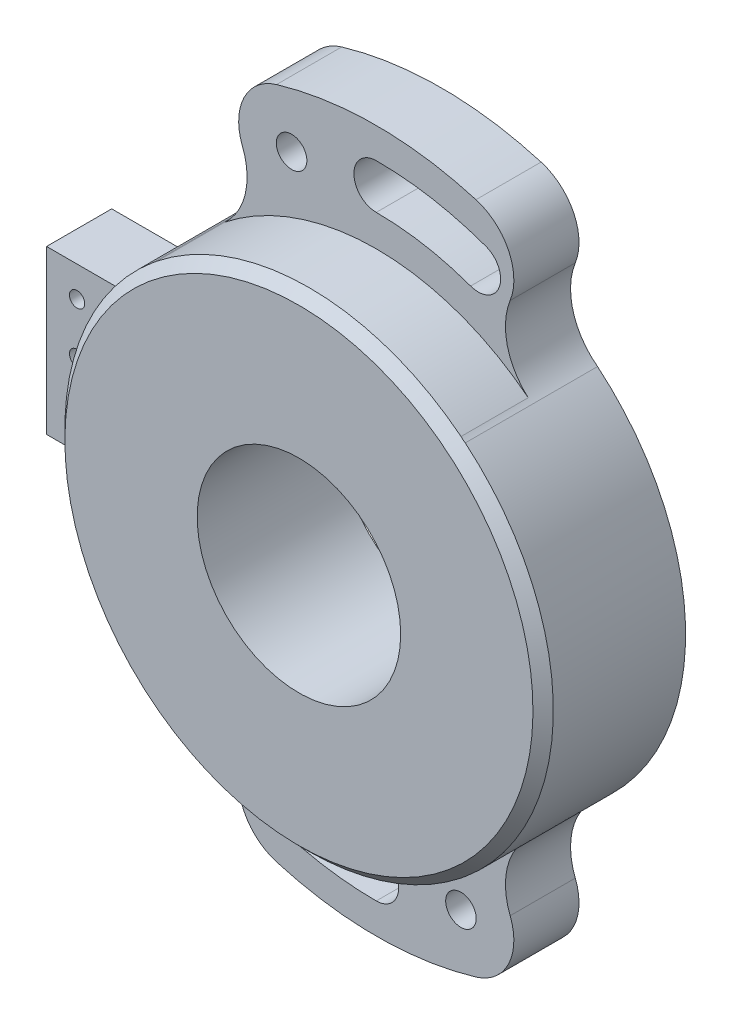
from build123d import *

# Parameters (mm, degrees)
SKETCH1_R           = 5
BOSS_EXTRUDE1_DEPTH = 7
SKETCH1_3_R         = 0.75
SKETCH1_3_R_2       = 0.37500000000000105
SKETCH1_3_R_3       = 0.375000000000001
SKETCH1_3_R_4       = 0.7500000000000001
BOSS_EXTRUDE2_DEPTH = 3.2
CHAMFER1_SIZE       = 0.5


with BuildPart() as part:
    # Sketch1 → Boss-Extrude1 (new body)
    with BuildSketch(Plane.XY):
        with BuildLine():
            ThreePointArc((-7.67241426287147, 9.226811983501475), (-9.846222893058407, 6.8594383691533025), (-11.31370849898476, 4))
            ThreePointArc((-11.31370849898476, 4), (-12, 1.47e-15), (-11.313708498984761, -3.9999999999999973))
            ThreePointArc((-11.313708498984761, -3.9999999999999973), (-9.846222893058428, -6.859438369153274), (-7.672414262871522, -9.226811983501433))
            ThreePointArc((-7.672414262871518, -9.226811983501431), (-7.566872377799013, -9.309109229750973), (-7.464748895834485, -9.395611950380768))
            ThreePointArc((-7.464748895834483, -9.395611950380767), (1.911e-14, -12), (7.464748895834521, -9.395611950380736))
            ThreePointArc((7.464748895834522, -9.395611950380738), (7.566872377798977, -9.309109229751012), (7.6724142628714045, -9.226811983501536))
            ThreePointArc((7.672414262871396, -9.226811983501538), (10.864367702596793, -5.0956368024783405), (12, -2.94e-15))
            ThreePointArc((12, 0), (10.864367702596812, 5.095636802478297), (7.672414262871458, 9.226811983501484))
            ThreePointArc((7.672414262871453, 9.22681198350148), (7.5668723777987985, 9.309109229751144), (7.4647488958341315, 9.395611950381072))
            ThreePointArc((7.464748895834118, 9.395611950381056), (-2.7638e-13, 12), (-7.464748895834552, 9.395611950380712))
            ThreePointArc((-7.464748895834552, 9.395611950380712), (-7.566872377799023, 9.30910922975097), (-7.672414262871468, 9.226811983501477))
        make_face()
        Circle(SKETCH1_R, mode=Mode.SUBTRACT)
    extrude(amount=BOSS_EXTRUDE1_DEPTH)

    # Sketch1<3> → Boss-Extrude2 (add)
    # profile 1 of 3: a face of its own
    with BuildSketch(Plane.XY):
        with BuildLine():
            ThreePointArc((-6.57839458957231, 13.089966563130929), (-6.4376977661817865, 11.10270546197924), (-7.464748895834552, 9.395611950380712))
            ThreePointArc((-7.464748895834552, 9.395611950380712), (-2.7638e-13, 12), (7.464748895834118, 9.395611950381056))
            ThreePointArc((7.4647488958341315, 9.395611950381072), (6.437697766181707, 11.102705461979504), (6.578394589572291, 13.089966563130933))
            ThreePointArc((6.578394589572291, 13.089966563130933), (6.498593335336791, 15.184618723292306), (4.899264696142665, 16.53964042647633))
            ThreePointArc((4.899264696142668, 16.539640426476332), (-9.55e-15, 17.250000000000007), (-4.899264696142684, 16.539640426476325))
            ThreePointArc((-4.899264696142685, 16.539640426476325), (-6.49859333533681, 15.184618723292303), (-6.57839458957231, 13.089966563130929))
        make_face()
        with Locations((-4.160824799912482, 14.046709115819024)):
            Circle(SKETCH1_3_R, mode=Mode.SUBTRACT)
        with BuildLine():
            ThreePointArc((-2e-17, 13.55), (-1.1000000000000003, 14.65), (1.8e-16, 15.75))
            ThreePointArc((1.8e-16, 15.75), (2.734958798254155, 15.510722109942275), (5.3868172573792865, 14.800158777378059))
            ThreePointArc((5.3868172573792865, 14.800158777378059), (6.04425698258554, 13.390274736855329), (4.634372942062814, 12.732835011649062))
            ThreePointArc((4.634372942062814, 12.732835011649065), (2.352932807386907, 13.344145053315419), (-2e-17, 13.550000000000002))
        make_face(mode=Mode.SUBTRACT)
    # profile 2 of 3: a face of its own
    with BuildSketch(Plane.XY):
        with BuildLine():
            Line((-11.313708498984761, 3.9999999999999982), (-16.2, 4))
            Line((-16.2, 4), (-16.2, -4))
            Line((-16.2, -4), (-11.313708498984761, -3.9999999999999982))
            ThreePointArc((-11.313708498984761, -3.9999999999999973), (-12, 1.47e-15), (-11.31370849898476, 4))
        make_face()
        with Locations((-14.7, -2.5)):
            Circle(SKETCH1_3_R_2, mode=Mode.SUBTRACT)
        with Locations((-14.7, 0)):
            Circle(SKETCH1_3_R_3, mode=Mode.SUBTRACT)
        with Locations((-14.7, 2.5)):
            Circle(SKETCH1_3_R_2, mode=Mode.SUBTRACT)
    # profile 3 of 3: a face of its own
    with BuildSketch(Plane.XY):
        with BuildLine():
            ThreePointArc((7.464748895834521, -9.395611950380736), (1.911e-14, -12), (-7.464748895834483, -9.395611950380767))
            ThreePointArc((-7.464748895834485, -9.395611950380768), (-6.437697766181827, -11.102705461979276), (-6.578394589572382, -13.08996656313089))
            ThreePointArc((-6.578394589572383, -13.08996656313089), (-6.498593335336874, -15.184618723292306), (-4.899264696142685, -16.539640426476325))
            ThreePointArc((-4.899264696142686, -16.539640426476325), (-2e-15, -17.250000000000004), (4.899264696142684, -16.53964042647633))
            ThreePointArc((4.899264696142683, -16.539640426476325), (6.498593335336733, -15.184618723292296), (6.57839458957222, -13.089966563130977))
            ThreePointArc((6.57839458957222, -13.089966563130977), (6.437697766181717, -11.102705461979264), (7.464748895834522, -9.395611950380738))
        make_face()
        with BuildLine():
            ThreePointArc((-4.634372942062905, -12.732835011649033), (-2.3529328073870017, -13.344145053315408), (-9.46e-14, -13.550000000000006))
            ThreePointArc((-9.46e-14, -13.550000000000004), (1.099999999999898, -14.650000000000011), (-1.1017e-13, -15.750000000000004))
            ThreePointArc((-1.1017e-13, -15.750000000000004), (-2.734958798254263, -15.510722109942261), (-5.3868172573793895, -14.800158777378023))
            ThreePointArc((-5.3868172573793895, -14.800158777378021), (-6.044256982585632, -13.390274736855288), (-4.634372942062904, -12.73283501164903))
        make_face(mode=Mode.SUBTRACT)
        with Locations((4.160824799912384, -14.046709115819057)):
            Circle(SKETCH1_3_R_4, mode=Mode.SUBTRACT)
    extrude(amount=BOSS_EXTRUDE2_DEPTH)

    # Chamfer1
    # the kernel refuses this chamfer: 0.5 mm, written as the material it takes off along each edge
    with BuildSketch(Plane(origin=(4.4e-16, 8.88e-15, 7), x_dir=(-0.7022542311891906, -0.7119262565581345, 0), z_dir=(-0.7119262565581345, 0.7022542311891906, 0))) as chamfer1_piece_1:
        Polygon((12.00000000000001, -CHAMFER1_SIZE), (12.00000000000001 - CHAMFER1_SIZE, 0), (12.00000000000001, 0), align=None)
    revolve(axis=Axis((4.4e-16, 8.88e-15, 7), (0, 0, 1)), revolution_arc=89.21628448783436, mode=Mode.SUBTRACT)
    with BuildSketch(Plane(origin=(0, -1.55e-15, 7), x_dir=(0.5534232565861029, 0.8329001735319981, 0), z_dir=(-0.8329001735319981, 0.5534232565861029, 0))) as chamfer1_piece_2:
        Polygon((12.000000000000009, CHAMFER1_SIZE), (12.000000000000009 - CHAMFER1_SIZE, 0), (12.000000000000009, 0), align=None)
    revolve(axis=Axis((0, -1.55e-15, 7), (0, 0, -1)), revolution_arc=112.79563771505457, mode=Mode.SUBTRACT)
    with BuildSketch(Plane(origin=(0, 0, 7), x_dir=(0.7022542311891632, 0.7119262565581616, 0), z_dir=(0.7119262565581616, -0.7022542311891632, 0))) as chamfer1_piece_3:
        Polygon((12.000000000000002, -CHAMFER1_SIZE), (12.000000000000002 - CHAMFER1_SIZE, 0), (12.000000000000002, 0), align=None)
    revolve(axis=Axis((0, 0, 7), (0, 0, 1)), revolution_arc=89.2162844878324, mode=Mode.SUBTRACT)
    with BuildSketch(Plane(origin=(-2.309e-14, -1.688e-14, 7), x_dir=(-0.5534232565861079, -0.8329001735319947, 0), z_dir=(0.8329001735319947, -0.5534232565861079, 0))) as chamfer1_piece_4:
        Polygon((12.00000000000003, CHAMFER1_SIZE), (12.00000000000003 - CHAMFER1_SIZE, 0), (12.00000000000003, 0), align=None)
    revolve(axis=Axis((-2.309e-14, -1.688e-14, 7), (0, 0, -1)), revolution_arc=112.79563771505396, mode=Mode.SUBTRACT)


solid = part.part
